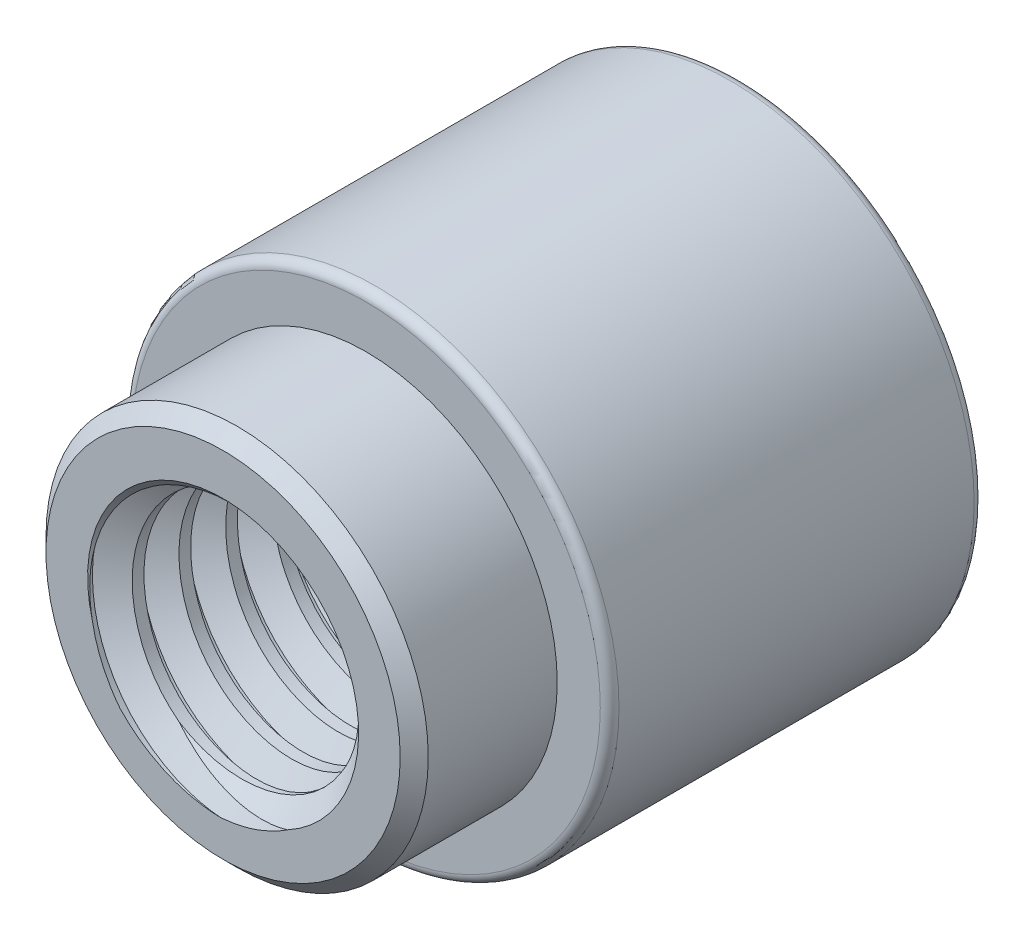
from build123d import *

# Parameters (mm, degrees)
GEWINDE1_PITCH = 0.5


with BuildPart() as part:
    # Skizze1 → Rotation1 (revolve)
    with BuildSketch(Plane(origin=(0, 0, 0), x_dir=(0, 0, -1), z_dir=(1, 0, 0)), mode=Mode.PRIVATE) as rotation1_sk:
        with BuildLine():
            ThreePointArc((3.9, 2.605846478), (3.970710678, 2.576557156), (4, 2.505846478))
            Line((4, 2.505846478), (4, 1.25))
            Line((4, 1.25), (0, 1.25))
            Line((0, 1.25), (-1.53, 1.25))
            Line((-1.53, 1.25), (-1.53, 1.895))
            Line((-1.53, 1.895), (-1.38, 2.045))
            Line((-1.38, 2.045), (0, 2.045))
            Line((0, 2.045), (0, 2.505846478))
            ThreePointArc((0, 2.505846478), (0.029289322, 2.576557156), (0.1, 2.605846478))
            Line((0.1, 2.605846478), (3.9, 2.605846478))
        make_face()
    revolve(rotation1_sk.sketch.rotate(Axis((0, 0, 1.53), (0, 0, -1)), 90), axis=Axis((0, 0, 1.53), (0, 0, -1)))

    # Gewinde1: the profile of Gewindeprofil1 profile screwed along a right-hand helix of 13.06 turns, 6 arcs to a turn; built about Z, then put on its axis
    gewinde1_z = Axis((0, 0, 0), (0, 0, 1))
    gewinde1_corners = [(1.2497, 0, -0.000173205), (1.520632937, 0, 0.156249999), (1.520632937, 0, 0.218749999), (1.2497, 0, 0.375173204)]
    with BuildLine(mode=Mode.PRIVATE) as gewinde1_profile:
        Line(gewinde1_corners[0], gewinde1_corners[1])
        Line(gewinde1_corners[1], gewinde1_corners[2])
        Line(gewinde1_corners[2], gewinde1_corners[3])
        Line(gewinde1_corners[3], gewinde1_corners[0])
    gewinde1_cap = Face(gewinde1_profile.wire())
    gewinde1_turn_angles = [0, 30, 60, 90, 120, 150, 180, 210, 240, 270, 300, 330, 360]
    gewinde1_turn_weights = [1, 0.8660254037844387, 1, 0.8660254037844387, 1, 0.8660254037844387, 1, 0.8660254037844387, 1, 0.8660254037844387, 1, 0.8660254037844387, 1]
    gewinde1_turn_rails = [Edge.make_bspline([Vector(p[0], p[1], 0).rotate(gewinde1_z, gewinde1_turn_angles[k]) / gewinde1_turn_weights[k] + Vector(0, 0, p[2] + GEWINDE1_PITCH * gewinde1_turn_angles[k] / 360) for k in range(13)], [0, 0, 0, 1, 1, 2, 2, 3, 3, 4, 4, 5, 5, 6, 6, 6], 2, gewinde1_turn_weights) for p in gewinde1_corners]
    gewinde1_turn_sides = [Face.make_surface_from_curves(gewinde1_turn_rails[p[0]], gewinde1_turn_rails[p[1]]) for p in [(0, 1), (1, 2), (2, 3), (3, 0)]]
    gewinde1_last_angles = [4680, 4690.8, 4701.6]
    gewinde1_last_weights = [1, 0.982287250728688, 1]
    gewinde1_last_rails = [Edge.make_bspline([Vector(p[0], p[1], 0).rotate(gewinde1_z, gewinde1_last_angles[k]) / gewinde1_last_weights[k] + Vector(0, 0, p[2] + GEWINDE1_PITCH * gewinde1_last_angles[k] / 360) for k in range(3)], [0, 0, 0, 1, 1, 1], 2, gewinde1_last_weights) for p in gewinde1_corners]
    gewinde1_last_sides = [Face.make_surface_from_curves(gewinde1_last_rails[p[0]], gewinde1_last_rails[p[1]]) for p in [(0, 1), (1, 2), (2, 3), (3, 0)]]
    gewinde1 = Plane(origin=(0, 0, -5), x_dir=(1, 0, 0), z_dir=(0, 0, 1)) * Solid(Shell([*[p.moved(Location((0, 0, GEWINDE1_PITCH * i))) for i in range(13) for p in gewinde1_turn_sides], *gewinde1_last_sides, gewinde1_cap, gewinde1_cap.rotate(gewinde1_z, 4701.6).moved(Location((0, 0, GEWINDE1_PITCH * 4701.6 / 360)))]))
    add(gewinde1, mode=Mode.SUBTRACT)

    # Skizze4 → Schnitt-Rotation1 (revolve, cut)
    with BuildSketch(Plane(origin=(0, 0, 0), x_dir=(0, 0, -1), z_dir=(1, 0, 0))):
        Polygon((-1.53, 1.45), (-1.33, 1.25), (-1.53, 1.25), align=None)
        Polygon((4, 1.45), (4, 1.25), (2.8, 1.25), align=None)
    revolve(axis=Axis((0, 0, 1.53), (0, 0, -1)), mode=Mode.SUBTRACT)


solid = part.part
